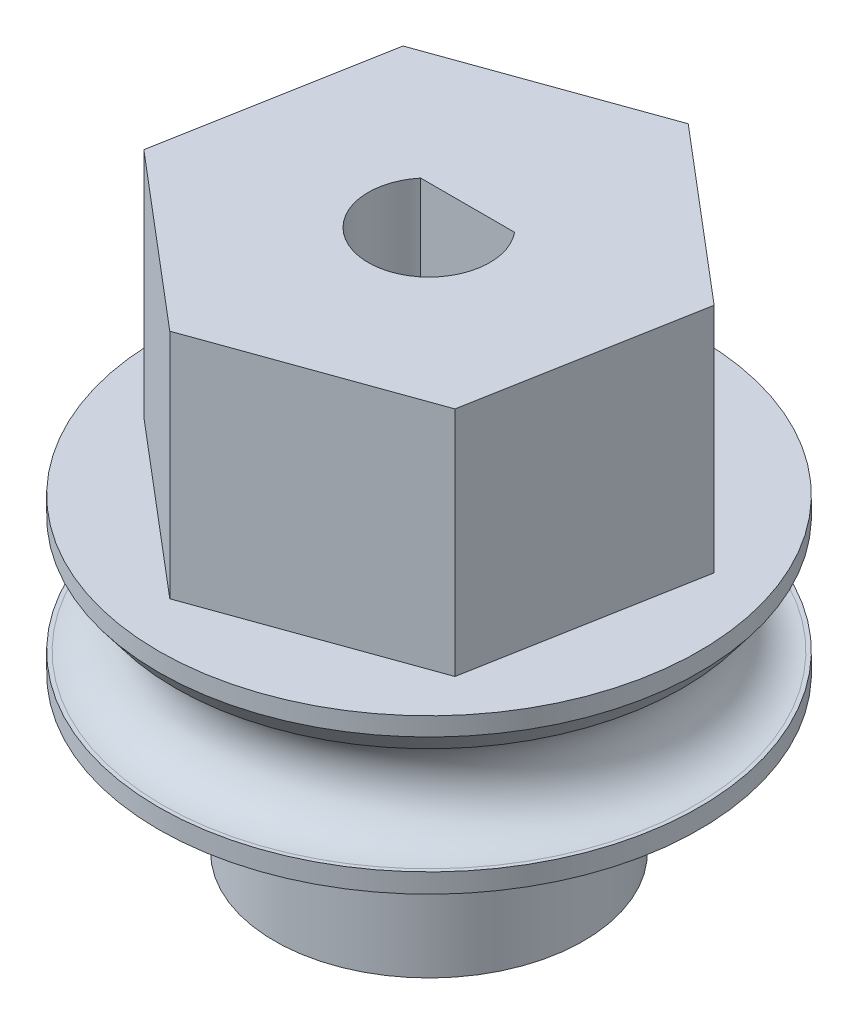
from build123d import *

# Parameters (mm, degrees)
BOSS_EXTRUDE1_DEPTH    = 7.62
MOTOR_SHAFT_DEPTH      = 17.164461018
MOTOR_SHAFT_DEPTH_BACK = 17.164461018


with BuildPart() as part:
    # Sketch1 → Boss-Extrude1 (new body)
    with BuildSketch(Plane(origin=(0, 0, 0), x_dir=(1, 0, 0), z_dir=(0, 1, 0))):
        Polygon((6.902283212, 2.474231151), (1.308394574, 7.214668182), (-5.593888638, 4.74043703), (-6.902283212, -2.474231151), (-1.308394574, -7.214668182), (5.593888638, -4.74043703), align=None)
    extrude(amount=BOSS_EXTRUDE1_DEPTH)

    # Sketch5 → Revolve1 (revolve)
    with BuildSketch(Plane(origin=(0, 0, 0), x_dir=(0, 0, -1), z_dir=(1, 0, 0)), mode=Mode.PRIVATE) as revolve1_sk:
        with BuildLine():
            Line((0, 0), (-8.89, 0))
            Line((-8.89, 0), (-8.89, -1.27))
            Line((-8.89, -1.27), (-8.763, -1.27))
            ThreePointArc((-8.763, -1.27), (-7.1755, -2.8575), (-8.763, -4.445))
            Line((-8.763, -4.445), (-8.89, -4.445))
            Line((-8.89, -4.445), (-8.89, -5.08))
            Line((-8.89, -5.08), (-5.08, -5.08))
            Line((-5.08, -5.08), (-5.08, -10.16))
            Line((-5.08, -10.16), (0, -10.16))
            Line((0, -10.16), (0, -5.08))
            Line((0, -5.08), (0, 0))
        make_face()
    revolve(revolve1_sk.sketch.rotate(Axis((0, 0, 0), (0, 1, 0)), 180), axis=Axis((0, 0, 0), (0, 1, 0)))

    # Chamfer5: read off the stored shape, not the designer's step
    # Chamfer5 outline → Chamfer5 (revolve, cut)
    with BuildSketch(Plane.XY):
        Polygon((8.339893048, -1.32742263), (8.763, -1.32742263), (8.763, -1.27), (8.89, -1.27), (8.89, -0.604551432), align=None)
    revolve(axis=Axis((0, 0, 0), (0, 1, 0)), mode=Mode.SUBTRACT)

    # Sketch10 → motor shaft (cut, two sides: drawn at the far end of the back side and taken through both)
    with BuildSketch(Plane(origin=(0, 0, 0), x_dir=(1, 0, 0), z_dir=(0, 1, 0)).offset(-MOTOR_SHAFT_DEPTH_BACK)):
        with BuildLine():
            Line((1.545024355, 1.27), (-1.545024355, 1.27))
            ThreePointArc((-1.545024355, 1.27), (-0.674518883, -1.882823553), (2.000000064, 0))
            ThreePointArc((2.000000064, 0), (1.882823553, 0.674518883), (1.545024355, 1.27))
        make_face()
    extrude(amount=MOTOR_SHAFT_DEPTH + MOTOR_SHAFT_DEPTH_BACK, mode=Mode.SUBTRACT)


solid = part.part
